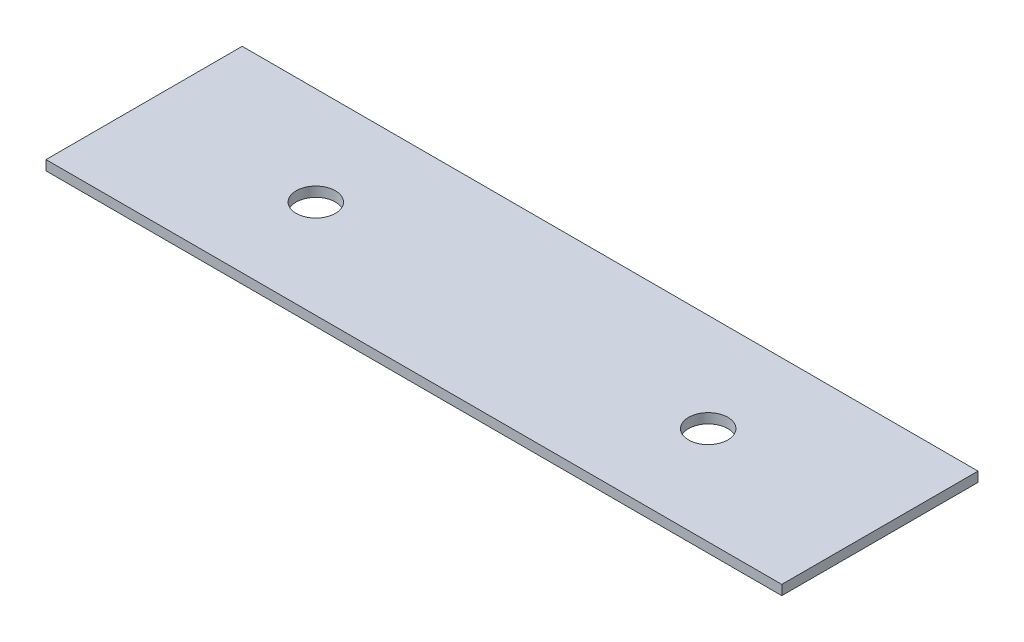
from build123d import *

# Parameters (mm, degrees)
SKETCH1_W          = 150
SKETCH1_H          = 40
BASE_FLANGE1_DEPTH = 2
SKETCH4_R          = 4
CUT_EXTRUDE1_DEPTH = 2


# Sheet-metal steps are written as plain solids
with BuildPart() as part:
    # Sketch1 → Base-Flange1 (new body)
    with BuildSketch(Plane(origin=(0, 0, 0), x_dir=(1, 0, 0), z_dir=(0, 1, 0))):
        Rectangle(SKETCH1_W, SKETCH1_H)
    extrude(amount=-BASE_FLANGE1_DEPTH)

    # Sketch4 → Cut-Extrude1 (cut)
    with BuildSketch(Plane(origin=(0, 0, 0), x_dir=(1, 0, 0), z_dir=(0, 1, 0))):
        with Locations(Location((-40, 0, 0), (0, 0, 270))):
            Circle(SKETCH4_R)
        with Locations(Location((40, 0, 0), (0, 0, 90))):
            Circle(SKETCH4_R)
    extrude(amount=-CUT_EXTRUDE1_DEPTH, mode=Mode.SUBTRACT)


solid = part.part
